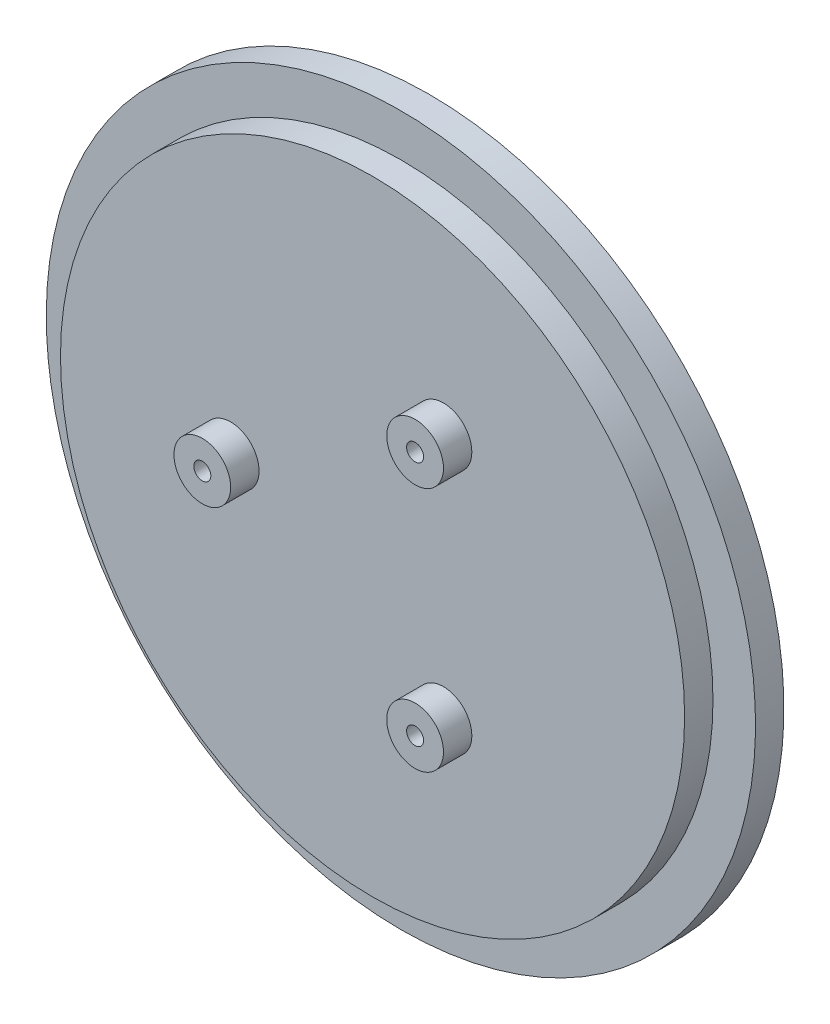
from build123d import *

# Parameters (mm, degrees)
SKETCH_1_R          = 22
EXTRUDE_1_DEPTH     = 2
SKETCH_2_R          = 2
SKETCH_2_R_2        = 0.6
EXTRUDE_2_DEPTH     = 4
SKETCH_3_R          = 25
EXTRUDE_3_DEPTH     = 2
CUT_EXTRUDE_1_DEPTH = 2
SKETCH_5_W          = 7.301488753
SKETCH_5_H          = 7.9
CUT_EXTRUDE_2_DEPTH = 1
SKETCH_6_R          = 5.45
SKETCH_6_R_2        = 3.85
CUT_EXTRUDE_3_DEPTH = 1.3
CUT_EXTRUDE_START   = -18.5
SKETCH_8_R          = 0.6
CUT_EXTRUDE_4_DEPTH = 18.5
SKETCH_9_R          = 16.695755265
CUT_EXTRUDE_5_DEPTH = 2
SKETCH_10_R         = 1.6
CUT_EXTRUDE_6_DEPTH = 1
SKETCH_11_R         = 1.6
CUT_EXTRUDE_7_DEPTH = 3


with BuildPart() as part:
    # 草图1 → 凸台-拉伸1 (new body)
    with BuildSketch(Plane.XY):
        Circle(SKETCH_1_R)
    extrude(amount=EXTRUDE_1_DEPTH)

    # 草图2 → 凸台-拉伸2 (add)
    # profile 1 of 3: a face of its own
    with BuildSketch(Plane.XY.offset(2)):
        with Locations((-10, 0)):
            Circle(SKETCH_2_R)
        with Locations((-10, 0)):
            Circle(SKETCH_2_R_2, mode=Mode.SUBTRACT)
    # profile 2 of 3: a face of its own
    with BuildSketch(Plane.XY.offset(2)):
        with Locations((5, 8.660254038)):
            Circle(SKETCH_2_R)
        with Locations((5, 8.660254038)):
            Circle(SKETCH_2_R_2, mode=Mode.SUBTRACT)
    # profile 3 of 3: a face of its own
    with BuildSketch(Plane.XY.offset(2)):
        with Locations((5, -8.660254038)):
            Circle(SKETCH_2_R)
        with Locations((5, -8.660254038)):
            Circle(SKETCH_2_R_2, mode=Mode.SUBTRACT)
    extrude(amount=EXTRUDE_2_DEPTH)

    # 草图3 → 凸台-拉伸3 (add)
    with BuildSketch(Plane(origin=(0, 0, 0), x_dir=(-1, 0, 0), z_dir=(0, 0, -1))):
        Circle(SKETCH_3_R)
    extrude(amount=EXTRUDE_3_DEPTH)

    # 草图4 → 切除-拉伸1 (cut)
    with BuildSketch(Plane(origin=(0, 0, -2), x_dir=(-1, 0, 0), z_dir=(0, 0, -1))):
        with BuildLine():
            Line((-7.25, 3.95), (7.25, 3.95))
            ThreePointArc((7.25, 3.95), (11.2, 0), (7.25, -3.95))
            Line((7.25, -3.95), (-7.25, -3.95))
            ThreePointArc((-7.25, -3.95), (-11.2, 0), (-7.25, 3.95))
        make_face()
    extrude(amount=-CUT_EXTRUDE_1_DEPTH, mode=Mode.SUBTRACT)

    # 草图5 → 切除-拉伸2 (cut)
    with BuildSketch(Plane(origin=(0, 0, -2), x_dir=(-1, 0, 0), z_dir=(0, 0, -1))):
        with Locations((24.650744377, 0)):
            Rectangle(SKETCH_5_W, SKETCH_5_H)
    extrude(amount=-CUT_EXTRUDE_2_DEPTH, mode=Mode.SUBTRACT)

    # 草图6 → 切除-拉伸3 (cut)
    # profile 1 of 3: a face of its own
    with BuildSketch(Plane(origin=(0, 0, -2), x_dir=(-1, 0, 0), z_dir=(0, 0, -1))):
        with Locations((-18, 0)):
            Circle(SKETCH_6_R)
        with Locations((-18, 0)):
            Circle(SKETCH_6_R_2, mode=Mode.SUBTRACT)
    # profile 2 of 3: a face of its own
    with BuildSketch(Plane(origin=(0, 0, -2), x_dir=(-1, 0, 0), z_dir=(0, 0, -1))):
        with Locations((9, 15.588457268)):
            Circle(SKETCH_6_R)
        with Locations((9, 15.588457268)):
            Circle(SKETCH_6_R_2, mode=Mode.SUBTRACT)
    # profile 3 of 3: a face of its own
    with BuildSketch(Plane(origin=(0, 0, -2), x_dir=(-1, 0, 0), z_dir=(0, 0, -1))):
        with Locations((9, -15.588457268)):
            Circle(SKETCH_6_R)
        with Locations((9, -15.588457268)):
            Circle(SKETCH_6_R_2, mode=Mode.SUBTRACT)
    extrude(amount=-CUT_EXTRUDE_3_DEPTH, mode=Mode.SUBTRACT)

    # 草图8 → 切除-拉伸4 (cut)
    with BuildSketch(Plane.XY.offset(6).offset(CUT_EXTRUDE_START)):
        with Locations((5, -8.660254038)):
            Circle(SKETCH_8_R)
        with Locations((-10, 0)):
            Circle(SKETCH_8_R)
        with Locations((5, 8.660254038)):
            Circle(SKETCH_8_R)
    extrude(amount=CUT_EXTRUDE_4_DEPTH, mode=Mode.SUBTRACT)

    # 草图9 → 切除-拉伸5 (cut)
    with BuildSketch(Plane.XY.offset(6)):
        Circle(SKETCH_9_R)
    extrude(amount=-CUT_EXTRUDE_5_DEPTH, mode=Mode.SUBTRACT)

    # 草图10 → 切除-拉伸6 (cut)
    with BuildSketch(Plane(origin=(0, 0, -2), x_dir=(-1, 0, 0), z_dir=(0, 0, -1))):
        with Locations((-5, -8.660254038)):
            Circle(SKETCH_10_R)
        with Locations((-5, 8.660254038)):
            Circle(SKETCH_10_R)
    extrude(amount=-CUT_EXTRUDE_6_DEPTH, mode=Mode.SUBTRACT)

    # 草图11 → 切除-拉伸7 (cut)
    with BuildSketch(Plane(origin=(0, 0, -2), x_dir=(-1, 0, 0), z_dir=(0, 0, -1))):
        with Locations((10, 0)):
            Circle(SKETCH_11_R)
    extrude(amount=-CUT_EXTRUDE_7_DEPTH, mode=Mode.SUBTRACT)


solid = part.part
